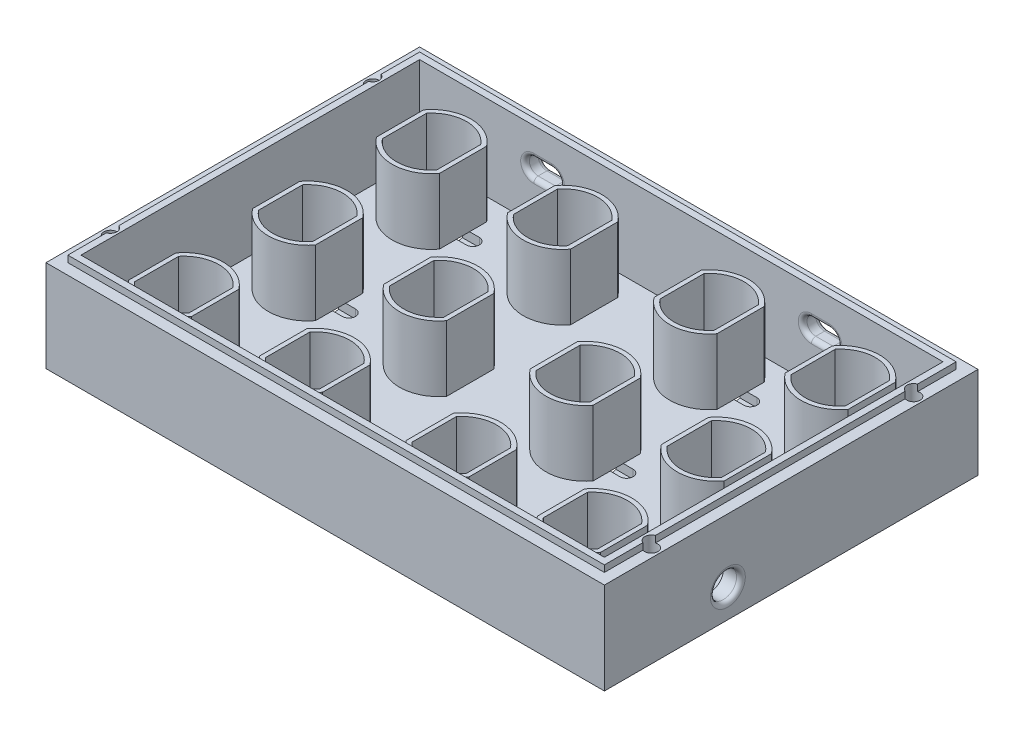
from build123d import *

# Parameters (mm, degrees)
BOSS_EXTRUDE1_DEPTH    = 15
BOSS_EXTRUDE1_2_DEPTH  = 15
BOSS_EXTRUDE1_3_DEPTH  = 15
BOSS_EXTRUDE1_4_DEPTH  = 15
BOSS_EXTRUDE1_5_DEPTH  = 15
BOSS_EXTRUDE1_6_DEPTH  = 15
BOSS_EXTRUDE1_7_DEPTH  = 15
BOSS_EXTRUDE1_8_DEPTH  = 15
BOSS_EXTRUDE1_9_DEPTH  = 15
BOSS_EXTRUDE1_10_DEPTH = 15
BOSS_EXTRUDE1_11_DEPTH = 15
BOSS_EXTRUDE1_12_DEPTH = 15
SKETCH5_W              = 127.76
SKETCH5_H              = 85.48
SKETCH5_W_2            = 119.76
SKETCH5_H_2            = 77.48
BOSS_EXTRUDE2_DEPTH    = 18
SKETCH6_W              = 127.76
SKETCH6_H              = 85.48
SKETCH6_R              = 5.75
BOSS_EXTRUDE3_DEPTH    = 3
SKETCH10_W             = 122.76
SKETCH10_H             = 80.48
SKETCH10_W_2           = 119.76
SKETCH10_H_2           = 77.48
BOSS_EXTRUDE4_DEPTH    = 1.5
SKETCH11_R             = 1.5
CUT_EXTRUDE1_DEPTH     = 4.5
CUT_EXTRUDE3_START     = 3
CUT_EXTRUDE3_DEPTH     = 5
CUT_EXTRUDE4_DEPTH     = 5
FILLET1_R              = 1
SKETCH15_R             = 3
CUT_EXTRUDE5_DEPTH     = 5
FILLET2_R              = 1


with BuildPart() as part:
    # Sketch4 → Boss-Extrude1 (new body)
    with BuildSketch(Plane(origin=(0, 0, 0), x_dir=(1, 0, 0), z_dir=(0, 1, 0))):
        with BuildLine():
            ThreePointArc((9.922, -19.795), (17.122, -23.395), (24.322, -19.795))
            Line((24.322, -19.795), (24.322, -8.995))
            ThreePointArc((24.322, -8.995), (17.122, -5.395), (9.922, -8.995))
            Line((9.922, -8.995), (9.922, -19.795))
        make_face()
        with BuildLine():
            Line((23.322, -9.339310136), (23.322, -19.450689864))
            ThreePointArc((23.322, -19.450689864), (17.122, -22.395), (10.922, -19.450689864))
            Line((10.922, -19.450689864), (10.922, -9.339310136))
            ThreePointArc((10.922, -9.339310136), (17.122, -6.395), (23.322, -9.339310136))
        make_face(mode=Mode.SUBTRACT)
    extrude(amount=BOSS_EXTRUDE1_DEPTH)


with BuildPart() as body_2:
    # Sketch4 → Boss-Extrude1 2 (new body)
    with BuildSketch(Plane(origin=(0, 0, 0), x_dir=(1, 0, 0), z_dir=(0, 1, 0))):
        with BuildLine():
            ThreePointArc((9.922, -48.14), (17.122, -51.74), (24.322, -48.14))
            Line((24.322, -48.14), (24.322, -37.34))
            ThreePointArc((24.322, -37.34), (17.122, -33.74), (9.922, -37.34))
            Line((9.922, -37.34), (9.922, -48.14))
        make_face()
        with BuildLine():
            Line((23.322, -37.684310136), (23.322, -47.795689864))
            ThreePointArc((23.322, -47.795689864), (17.122, -50.74), (10.922, -47.795689864))
            Line((10.922, -47.795689864), (10.922, -37.684310136))
            ThreePointArc((10.922, -37.684310136), (17.122, -34.74), (23.322, -37.684310136))
        make_face(mode=Mode.SUBTRACT)
    extrude(amount=BOSS_EXTRUDE1_2_DEPTH)


with BuildPart() as body_3:
    # Sketch4 → Boss-Extrude1 3 (new body)
    with BuildSketch(Plane(origin=(0, 0, 0), x_dir=(1, 0, 0), z_dir=(0, 1, 0))):
        with BuildLine():
            ThreePointArc((9.922, -76.485), (17.122, -80.085), (24.322, -76.485))
            Line((24.322, -76.485), (24.322, -65.685))
            ThreePointArc((24.322, -65.685), (17.122, -62.085), (9.922, -65.685))
            Line((9.922, -65.685), (9.922, -76.485))
        make_face()
        with BuildLine():
            Line((23.322, -66.029310136), (23.322, -76.140689864))
            ThreePointArc((23.322, -76.140689864), (17.122, -79.085), (10.922, -76.140689864))
            Line((10.922, -76.140689864), (10.922, -66.029310136))
            ThreePointArc((10.922, -66.029310136), (17.122, -63.085), (23.322, -66.029310136))
        make_face(mode=Mode.SUBTRACT)
    extrude(amount=BOSS_EXTRUDE1_3_DEPTH)


with BuildPart() as body_4:
    # Sketch4 → Boss-Extrude1 4 (new body)
    with BuildSketch(Plane(origin=(0, 0, 0), x_dir=(1, 0, 0), z_dir=(0, 1, 0))):
        with BuildLine():
            ThreePointArc((39.922, -19.795), (47.122, -23.395), (54.322, -19.795))
            Line((54.322, -19.795), (54.322, -8.995))
            ThreePointArc((54.322, -8.995), (47.122, -5.395), (39.922, -8.995))
            Line((39.922, -8.995), (39.922, -19.795))
        make_face()
        with BuildLine():
            Line((53.322, -9.339310136), (53.322, -19.450689864))
            ThreePointArc((53.322, -19.450689864), (47.122, -22.395), (40.922, -19.450689864))
            Line((40.922, -19.450689864), (40.922, -9.339310136))
            ThreePointArc((40.922, -9.339310136), (47.122, -6.395), (53.322, -9.339310136))
        make_face(mode=Mode.SUBTRACT)
    extrude(amount=BOSS_EXTRUDE1_4_DEPTH)


with BuildPart() as body_5:
    # Sketch4 → Boss-Extrude1 5 (new body)
    with BuildSketch(Plane(origin=(0, 0, 0), x_dir=(1, 0, 0), z_dir=(0, 1, 0))):
        with BuildLine():
            ThreePointArc((39.922, -48.14), (47.122, -51.74), (54.322, -48.14))
            Line((54.322, -48.14), (54.322, -37.34))
            ThreePointArc((54.322, -37.34), (47.122, -33.74), (39.922, -37.34))
            Line((39.922, -37.34), (39.922, -48.14))
        make_face()
        with BuildLine():
            Line((53.322, -37.684310136), (53.322, -47.795689864))
            ThreePointArc((53.322, -47.795689864), (47.122, -50.74), (40.922, -47.795689864))
            Line((40.922, -47.795689864), (40.922, -37.684310136))
            ThreePointArc((40.922, -37.684310136), (47.122, -34.74), (53.322, -37.684310136))
        make_face(mode=Mode.SUBTRACT)
    extrude(amount=BOSS_EXTRUDE1_5_DEPTH)


with BuildPart() as body_6:
    # Sketch4 → Boss-Extrude1 6 (new body)
    with BuildSketch(Plane(origin=(0, 0, 0), x_dir=(1, 0, 0), z_dir=(0, 1, 0))):
        with BuildLine():
            ThreePointArc((39.922, -76.485), (47.122, -80.085), (54.322, -76.485))
            Line((54.322, -76.485), (54.322, -65.685))
            ThreePointArc((54.322, -65.685), (47.122, -62.085), (39.922, -65.685))
            Line((39.922, -65.685), (39.922, -76.485))
        make_face()
        with BuildLine():
            Line((53.322, -66.029310136), (53.322, -76.140689864))
            ThreePointArc((53.322, -76.140689864), (47.122, -79.085), (40.922, -76.140689864))
            Line((40.922, -76.140689864), (40.922, -66.029310136))
            ThreePointArc((40.922, -66.029310136), (47.122, -63.085), (53.322, -66.029310136))
        make_face(mode=Mode.SUBTRACT)
    extrude(amount=BOSS_EXTRUDE1_6_DEPTH)


with BuildPart() as body_7:
    # Sketch4 → Boss-Extrude1 7 (new body)
    with BuildSketch(Plane(origin=(0, 0, 0), x_dir=(1, 0, 0), z_dir=(0, 1, 0))):
        with BuildLine():
            ThreePointArc((73.438, -19.795), (80.638, -23.395), (87.838, -19.795))
            Line((87.838, -19.795), (87.838, -8.995))
            ThreePointArc((87.838, -8.995), (80.638, -5.395), (73.438, -8.995))
            Line((73.438, -8.995), (73.438, -19.795))
        make_face()
        with BuildLine():
            Line((86.838, -9.339310136), (86.838, -19.450689864))
            ThreePointArc((86.838, -19.450689864), (80.638, -22.395), (74.438, -19.450689864))
            Line((74.438, -19.450689864), (74.438, -9.339310136))
            ThreePointArc((74.438, -9.339310136), (80.638, -6.395), (86.838, -9.339310136))
        make_face(mode=Mode.SUBTRACT)
    extrude(amount=BOSS_EXTRUDE1_7_DEPTH)


with BuildPart() as body_8:
    # Sketch4 → Boss-Extrude1 8 (new body)
    with BuildSketch(Plane(origin=(0, 0, 0), x_dir=(1, 0, 0), z_dir=(0, 1, 0))):
        with BuildLine():
            ThreePointArc((73.438, -48.14), (80.638, -51.74), (87.838, -48.14))
            Line((87.838, -48.14), (87.838, -37.34))
            ThreePointArc((87.838, -37.34), (80.638, -33.74), (73.438, -37.34))
            Line((73.438, -37.34), (73.438, -48.14))
        make_face()
        with BuildLine():
            Line((86.838, -37.684310136), (86.838, -47.795689864))
            ThreePointArc((86.838, -47.795689864), (80.638, -50.74), (74.438, -47.795689864))
            Line((74.438, -47.795689864), (74.438, -37.684310136))
            ThreePointArc((74.438, -37.684310136), (80.638, -34.74), (86.838, -37.684310136))
        make_face(mode=Mode.SUBTRACT)
    extrude(amount=BOSS_EXTRUDE1_8_DEPTH)


with BuildPart() as body_9:
    # Sketch4 → Boss-Extrude1 9 (new body)
    with BuildSketch(Plane(origin=(0, 0, 0), x_dir=(1, 0, 0), z_dir=(0, 1, 0))):
        with BuildLine():
            ThreePointArc((73.438, -76.485), (80.638, -80.085), (87.838, -76.485))
            Line((87.838, -76.485), (87.838, -65.685))
            ThreePointArc((87.838, -65.685), (80.638, -62.085), (73.438, -65.685))
            Line((73.438, -65.685), (73.438, -76.485))
        make_face()
        with BuildLine():
            Line((86.838, -66.029310136), (86.838, -76.140689864))
            ThreePointArc((86.838, -76.140689864), (80.638, -79.085), (74.438, -76.140689864))
            Line((74.438, -76.140689864), (74.438, -66.029310136))
            ThreePointArc((74.438, -66.029310136), (80.638, -63.085), (86.838, -66.029310136))
        make_face(mode=Mode.SUBTRACT)
    extrude(amount=BOSS_EXTRUDE1_9_DEPTH)


with BuildPart() as body_10:
    # Sketch4 → Boss-Extrude1 10 (new body)
    with BuildSketch(Plane(origin=(0, 0, 0), x_dir=(1, 0, 0), z_dir=(0, 1, 0))):
        with BuildLine():
            ThreePointArc((103.438, -19.795), (110.638, -23.395), (117.838, -19.795))
            Line((117.838, -19.795), (117.838, -8.995))
            ThreePointArc((117.838, -8.995), (110.638, -5.395), (103.438, -8.995))
            Line((103.438, -8.995), (103.438, -19.795))
        make_face()
        with BuildLine():
            Line((116.838, -9.339310136), (116.838, -19.450689864))
            ThreePointArc((116.838, -19.450689864), (110.638, -22.395), (104.438, -19.450689864))
            Line((104.438, -19.450689864), (104.438, -9.339310136))
            ThreePointArc((104.438, -9.339310136), (110.638, -6.395), (116.838, -9.339310136))
        make_face(mode=Mode.SUBTRACT)
    extrude(amount=BOSS_EXTRUDE1_10_DEPTH)


with BuildPart() as body_11:
    # Sketch4 → Boss-Extrude1 11 (new body)
    with BuildSketch(Plane(origin=(0, 0, 0), x_dir=(1, 0, 0), z_dir=(0, 1, 0))):
        with BuildLine():
            ThreePointArc((103.438, -48.14), (110.638, -51.74), (117.838, -48.14))
            Line((117.838, -48.14), (117.838, -37.34))
            ThreePointArc((117.838, -37.34), (110.638, -33.74), (103.438, -37.34))
            Line((103.438, -37.34), (103.438, -48.14))
        make_face()
        with BuildLine():
            Line((116.838, -37.684310136), (116.838, -47.795689864))
            ThreePointArc((116.838, -47.795689864), (110.638, -50.74), (104.438, -47.795689864))
            Line((104.438, -47.795689864), (104.438, -37.684310136))
            ThreePointArc((104.438, -37.684310136), (110.638, -34.74), (116.838, -37.684310136))
        make_face(mode=Mode.SUBTRACT)
    extrude(amount=BOSS_EXTRUDE1_11_DEPTH)


with BuildPart() as body_12:
    # Sketch4 → Boss-Extrude1 12 (new body)
    with BuildSketch(Plane(origin=(0, 0, 0), x_dir=(1, 0, 0), z_dir=(0, 1, 0))):
        with BuildLine():
            ThreePointArc((103.438, -76.485), (110.638, -80.085), (117.838, -76.485))
            Line((117.838, -76.485), (117.838, -65.685))
            ThreePointArc((117.838, -65.685), (110.638, -62.085), (103.438, -65.685))
            Line((103.438, -65.685), (103.438, -76.485))
        make_face()
        with BuildLine():
            Line((116.838, -66.029310136), (116.838, -76.140689864))
            ThreePointArc((116.838, -76.140689864), (110.638, -79.085), (104.438, -76.140689864))
            Line((104.438, -76.140689864), (104.438, -66.029310136))
            ThreePointArc((104.438, -66.029310136), (110.638, -63.085), (116.838, -66.029310136))
        make_face(mode=Mode.SUBTRACT)
    extrude(amount=BOSS_EXTRUDE1_12_DEPTH)


with BuildPart() as body_13:
    # Sketch5 → Boss-Extrude2 (new body)
    with BuildSketch(Plane(origin=(0, 0, 0), x_dir=(1, 0, 0), z_dir=(0, 1, 0))):
        with Locations((63.88, -42.74)):
            Rectangle(SKETCH5_W, SKETCH5_H)
        with Locations((63.88, -42.74)):
            Rectangle(SKETCH5_W_2, SKETCH5_H_2, mode=Mode.SUBTRACT)
    extrude(amount=BOSS_EXTRUDE2_DEPTH)

    # Sketch6 → Boss-Extrude3 (add)
    with BuildSketch(Plane.XZ):
        with Locations((63.88, 42.74)):
            Rectangle(SKETCH6_W, SKETCH6_H)
        with Locations((17.122, 71.085)):
            Circle(SKETCH6_R, mode=Mode.SUBTRACT)
        with Locations((17.122, 42.74)):
            Circle(SKETCH6_R, mode=Mode.SUBTRACT)
        with Locations((17.122, 14.395)):
            Circle(SKETCH6_R, mode=Mode.SUBTRACT)
        with Locations((47.122, 42.74)):
            Circle(SKETCH6_R, mode=Mode.SUBTRACT)
        with Locations((47.122, 14.395)):
            Circle(SKETCH6_R, mode=Mode.SUBTRACT)
        with Locations((47.122, 71.085)):
            Circle(SKETCH6_R, mode=Mode.SUBTRACT)
        with Locations((80.638, 71.085)):
            Circle(SKETCH6_R, mode=Mode.SUBTRACT)
        with Locations((110.638, 71.085)):
            Circle(SKETCH6_R, mode=Mode.SUBTRACT)
        with Locations((110.638, 42.74)):
            Circle(SKETCH6_R, mode=Mode.SUBTRACT)
        with Locations((80.638, 42.74)):
            Circle(SKETCH6_R, mode=Mode.SUBTRACT)
        with Locations((80.638, 14.395)):
            Circle(SKETCH6_R, mode=Mode.SUBTRACT)
        with Locations((110.638, 14.395)):
            Circle(SKETCH6_R, mode=Mode.SUBTRACT)
    extrude(amount=BOSS_EXTRUDE3_DEPTH)

    # Sketch10 → Boss-Extrude4 (add)
    with BuildSketch(Plane(origin=(0, 18, 0), x_dir=(1, 0, 0), z_dir=(0, 1, 0))):
        with Locations((63.88, -42.74)):
            Rectangle(SKETCH10_W, SKETCH10_H)
        with Locations((63.88, -42.74)):
            Rectangle(SKETCH10_W_2, SKETCH10_H_2, mode=Mode.SUBTRACT)
    extrude(amount=BOSS_EXTRUDE4_DEPTH)

    # Sketch11 → Cut-Extrude1 (cut)
    with BuildSketch(Plane(origin=(0, 19.5, 0), x_dir=(1, 0, 0), z_dir=(0, 1, 0))):
        with Locations((2, -12.74)):
            Circle(SKETCH11_R)
        with Locations((2, -72.74)):
            Circle(SKETCH11_R)
        with Locations((125.76, -12.74)):
            Circle(SKETCH11_R)
        with Locations((125.76, -72.74)):
            Circle(SKETCH11_R)
    extrude(amount=-CUT_EXTRUDE1_DEPTH, mode=Mode.SUBTRACT)

    # Sketch13 → Cut-Extrude3 (cut)
    with BuildSketch(Plane(origin=(0, 0, 0), x_dir=(1, 0, 0), z_dir=(0, 1, 0)).offset(CUT_EXTRUDE3_START)):
        with BuildLine():
            Line((17.122, -12.895), (26.572, -12.895))
            ThreePointArc((26.572, -12.895), (28.072, -14.395), (26.572, -15.895))
            Line((26.572, -15.895), (17.122, -15.895))
            ThreePointArc((17.122, -15.895), (15.622, -14.395), (17.122, -12.895))
        make_face()
        with BuildLine():
            Line((37.672, -12.895), (47.122, -12.895))
            ThreePointArc((47.122, -12.895), (48.622, -14.395), (47.122, -15.895))
            Line((47.122, -15.895), (37.672, -15.895))
            ThreePointArc((37.672, -15.895), (36.172, -14.395), (37.672, -12.895))
        make_face()
        with BuildLine():
            Line((37.672, -41.24), (47.122, -41.24))
            ThreePointArc((47.122, -41.24), (48.622, -42.74), (47.122, -44.24))
            Line((47.122, -44.24), (37.672, -44.24))
            ThreePointArc((37.672, -44.24), (36.172, -42.74), (37.672, -41.24))
        make_face()
        with BuildLine():
            Line((37.672, -69.585), (47.122, -69.585))
            ThreePointArc((47.122, -69.585), (48.622, -71.085), (47.122, -72.585))
            Line((47.122, -72.585), (37.672, -72.585))
            ThreePointArc((37.672, -72.585), (36.172, -71.085), (37.672, -69.585))
        make_face()
        with BuildLine():
            Line((17.122, -41.24), (26.572, -41.24))
            ThreePointArc((26.572, -41.24), (28.072, -42.74), (26.572, -44.24))
            Line((26.572, -44.24), (17.122, -44.24))
            ThreePointArc((17.122, -44.24), (15.622, -42.74), (17.122, -41.24))
        make_face()
        with BuildLine():
            Line((17.122, -69.585), (26.572, -69.585))
            ThreePointArc((26.572, -69.585), (28.072, -71.085), (26.572, -72.585))
            Line((26.572, -72.585), (17.122, -72.585))
            ThreePointArc((17.122, -72.585), (15.622, -71.085), (17.122, -69.585))
        make_face()
        with BuildLine():
            Line((80.638, -12.895), (90.088, -12.895))
            ThreePointArc((90.088, -12.895), (91.588, -14.395), (90.088, -15.895))
            Line((90.088, -15.895), (80.638, -15.895))
            ThreePointArc((80.638, -15.895), (79.138, -14.395), (80.638, -12.895))
        make_face()
        with BuildLine():
            Line((101.188, -12.895), (110.638, -12.895))
            ThreePointArc((110.638, -12.895), (112.138, -14.395), (110.638, -15.895))
            Line((110.638, -15.895), (101.188, -15.895))
            ThreePointArc((101.188, -15.895), (99.688, -14.395), (101.188, -12.895))
        make_face()
        with BuildLine():
            Line((101.188, -41.24), (110.638, -41.24))
            ThreePointArc((110.638, -41.24), (112.138, -42.74), (110.638, -44.24))
            Line((110.638, -44.24), (101.188, -44.24))
            ThreePointArc((101.188, -44.24), (99.688, -42.74), (101.188, -41.24))
        make_face()
        with BuildLine():
            Line((101.188, -69.585), (110.638, -69.585))
            ThreePointArc((110.638, -69.585), (112.138, -71.085), (110.638, -72.585))
            Line((110.638, -72.585), (101.188, -72.585))
            ThreePointArc((101.188, -72.585), (99.688, -71.085), (101.188, -69.585))
        make_face()
        with BuildLine():
            Line((80.638, -41.24), (90.088, -41.24))
            ThreePointArc((90.088, -41.24), (91.588, -42.74), (90.088, -44.24))
            Line((90.088, -44.24), (80.638, -44.24))
            ThreePointArc((80.638, -44.24), (79.138, -42.74), (80.638, -41.24))
        make_face()
        with BuildLine():
            Line((80.638, -69.585), (90.088, -69.585))
            ThreePointArc((90.088, -69.585), (91.588, -71.085), (90.088, -72.585))
            Line((90.088, -72.585), (80.638, -72.585))
            ThreePointArc((80.638, -72.585), (79.138, -71.085), (80.638, -69.585))
        make_face()
    extrude(amount=-CUT_EXTRUDE3_DEPTH, mode=Mode.SUBTRACT)

    # Sketch14 → Cut-Extrude4 (cut)
    with BuildSketch(Plane(origin=(0, 0, 0), x_dir=(-1, 0, 0), z_dir=(0, 0, -1))):
        with BuildLine():
            Line((-97.638, 13), (-93.638, 13))
            ThreePointArc((-93.638, 13), (-91.638, 11), (-93.638, 9))
            Line((-93.638, 9), (-97.638, 9))
            ThreePointArc((-97.638, 9), (-99.638, 11), (-97.638, 13))
        make_face()
        with BuildLine():
            Line((-34.122, 13), (-30.122, 13))
            ThreePointArc((-30.122, 13), (-28.122, 11), (-30.122, 9))
            Line((-30.122, 9), (-34.122, 9))
            ThreePointArc((-34.122, 9), (-36.122, 11), (-34.122, 13))
        make_face()
    extrude(amount=-CUT_EXTRUDE4_DEPTH, mode=Mode.SUBTRACT)

    # Fillet1
    fillet1_edges = [body_13.edges().sort_by_distance(p)[0] for p in [
        (36.122, 11, 4),
        (32.122, 9, 4),
        (28.122, 11, 4),
        (99.638, 11, 4),
        (95.638, 9, 4),
        (91.638, 11, 4),
        (28.122, 11, 0),
        (32.122, 9, 0),
        (36.122, 11, 0),
        (91.638, 11, 0),
        (95.638, 9, 0),
        (99.638, 11, 0),
        (32.122, 13, 4),
        (95.638, 13, 4),
        (32.122, 13, 0),
        (95.638, 13, 0),
    ]]
    fillet(fillet1_edges, radius=FILLET1_R)

    # Sketch15 → Cut-Extrude5 (cut)
    with BuildSketch(Plane(origin=(127.76, 0, 0), x_dir=(0, 0, -1), z_dir=(1, 0, 0))):
        with Locations((-57.235, 3.5)):
            Circle(SKETCH15_R)
    extrude(amount=-CUT_EXTRUDE5_DEPTH, mode=Mode.SUBTRACT)

    # Fillet2
    fillet2_edges = [body_13.edges().sort_by_distance(p)[0] for p in [
        (127.76, 3.5, 60.235),
    ]]
    fillet(fillet2_edges, radius=FILLET2_R)


solid = Compound([part.part, body_2.part, body_3.part, body_4.part, body_5.part, body_6.part, body_7.part, body_8.part, body_9.part, body_10.part, body_11.part, body_12.part, body_13.part])
